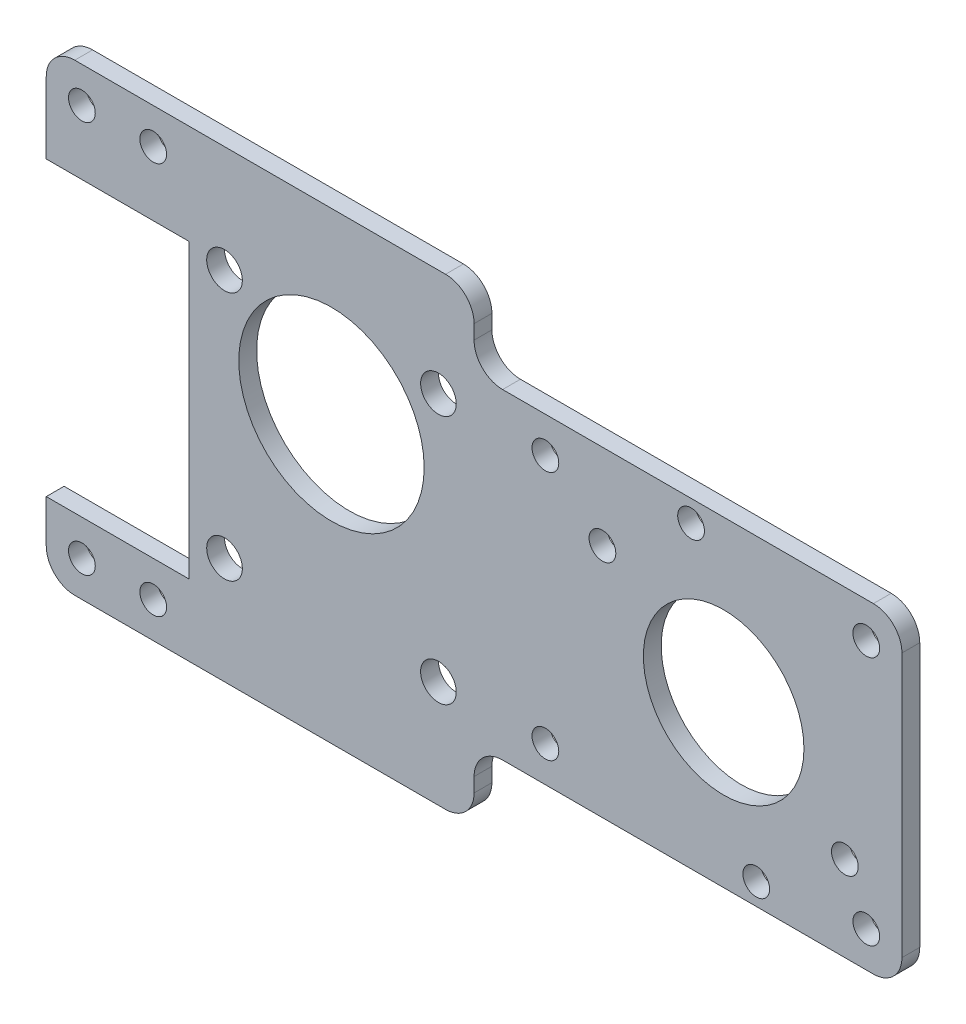
from build123d import *

# Parameters (mm, degrees)
SKETCH1_W           = 127
SKETCH1_H           = 57.15
SKETCH1_R           = 2.38125
SKETCH1_R_2         = 14.3002
BOSS_EXTRUDE1_DEPTH = 3.175
SKETCH2_R           = 2.38125
CUT_EXTRUDE1_DEPTH  = 3.175
FILLET1_R           = 5.08
SKETCH3_R           = 3.175
CUT_EXTRUDE2_DEPTH  = 3.175
SKETCH4_R           = 16.51
CUT_EXTRUDE3_DEPTH  = 7.62
SKETCH5_W           = 76.2
SKETCH5_H           = 12.7
BOSS_EXTRUDE2_DEPTH = 3.175
FILLET2_R           = 5.08
SKETCH6_W           = 25.4
SKETCH6_H           = 5.08
BOSS_EXTRUDE3_DEPTH = 3.175
FILLET3_R           = 5.08
SKETCH7_R           = 2.38125
CUT_EXTRUDE4_DEPTH  = 3.175


with BuildPart() as part:
    # Sketch1 → Boss-Extrude1 (new body)
    with BuildSketch(Plane.XY):
        Rectangle(SKETCH1_W, SKETCH1_H)
        with Locations((37.555148495, -24.727722316)):
            Circle(SKETCH1_R, mode=Mode.SUBTRACT)
        with Locations((53.34, -13.380280266)):
            Circle(SKETCH1_R, mode=Mode.SUBTRACT)
        with Locations((10.16, 13.380280266)):
            Circle(SKETCH1_R, mode=Mode.SUBTRACT)
        with Locations((31.75, 0)):
            Circle(SKETCH1_R_2, mode=Mode.SUBTRACT)
        with Locations((25.944851505, 24.727722316)):
            Circle(SKETCH1_R, mode=Mode.SUBTRACT)
    extrude(amount=BOSS_EXTRUDE1_DEPTH)

    # Sketch2 → Cut-Extrude1 (cut)
    with BuildSketch(Plane.XY.offset(3.175)):
        with Locations((57.15, 22.225)):
            Circle(SKETCH2_R)
        with Locations((57.15, -22.225)):
            Circle(SKETCH2_R)
        with Locations((0, 22.225)):
            Circle(SKETCH2_R)
        with Locations((0, -22.225)):
            Circle(SKETCH2_R)
    extrude(amount=-CUT_EXTRUDE1_DEPTH, mode=Mode.SUBTRACT)

    # Fillet1
    fillet1_edges = [part.edges().sort_by_distance(p)[0] for p in [
        (63.5, -28.575, 1.5875),
        (63.5, 28.575, 1.5875),
    ]]
    fillet(fillet1_edges, radius=FILLET1_R)

    # Sketch3 → Cut-Extrude2 (cut)
    with BuildSketch(Plane.XY.offset(3.175)):
        with Locations((-57.15, 22.225)):
            Circle(SKETCH3_R)
        with Locations((-19.05, 22.225)):
            Circle(SKETCH3_R)
        with Locations((-19.05, -22.225)):
            Circle(SKETCH3_R)
        with Locations((-57.15, -22.225)):
            Circle(SKETCH3_R)
    extrude(amount=-CUT_EXTRUDE2_DEPTH, mode=Mode.SUBTRACT)

    # Sketch4 → Cut-Extrude3 (cut)
    with BuildSketch(Plane.XY.offset(3.175)):
        with Locations((-38.1, 9.525)):
            Circle(SKETCH4_R)
    extrude(amount=-CUT_EXTRUDE3_DEPTH, mode=Mode.SUBTRACT)

    # Sketch5 → Boss-Extrude2 (add)
    with BuildSketch(Plane.XY.offset(3.175)):
        with Locations((-50.8, -34.925)):
            Rectangle(SKETCH5_W, SKETCH5_H)
        with Locations((-50.8, 34.925)):
            Rectangle(SKETCH5_W, SKETCH5_H)
    extrude(amount=-BOSS_EXTRUDE2_DEPTH)

    # Fillet2
    fillet2_edges = [part.edges().sort_by_distance(p)[0] for p in [
        (-12.7, -41.275, 1.5875),
        (-12.7, -28.575, 1.5875),
        (-12.7, 41.275, 1.5875),
        (-12.7, 28.575, 1.5875),
    ]]
    fillet(fillet2_edges, radius=FILLET2_R)

    # Sketch6 → Boss-Extrude3 (add)
    with BuildSketch(Plane.XY.offset(3.175)):
        with Locations((-76.2, 26.035)):
            Rectangle(SKETCH6_W, SKETCH6_H)
    extrude(amount=-BOSS_EXTRUDE3_DEPTH)

    # Fillet3
    fillet3_edges = [part.edges().sort_by_distance(p)[0] for p in [
        (-88.9, 41.275, 1.5875),
        (-88.9, -41.275, 1.5875),
    ]]
    fillet(fillet3_edges, radius=FILLET3_R)

    # Sketch7 → Cut-Extrude4 (cut)
    with BuildSketch(Plane.XY.offset(3.175)):
        with Locations((-82.55, 34.925)):
            Circle(SKETCH7_R)
        with Locations((-82.55, -34.925)):
            Circle(SKETCH7_R)
        with Locations((-69.85, 34.925)):
            Circle(SKETCH7_R)
        with Locations((-69.85, -34.925)):
            Circle(SKETCH7_R)
    extrude(amount=-CUT_EXTRUDE4_DEPTH, mode=Mode.SUBTRACT)


solid = part.part
